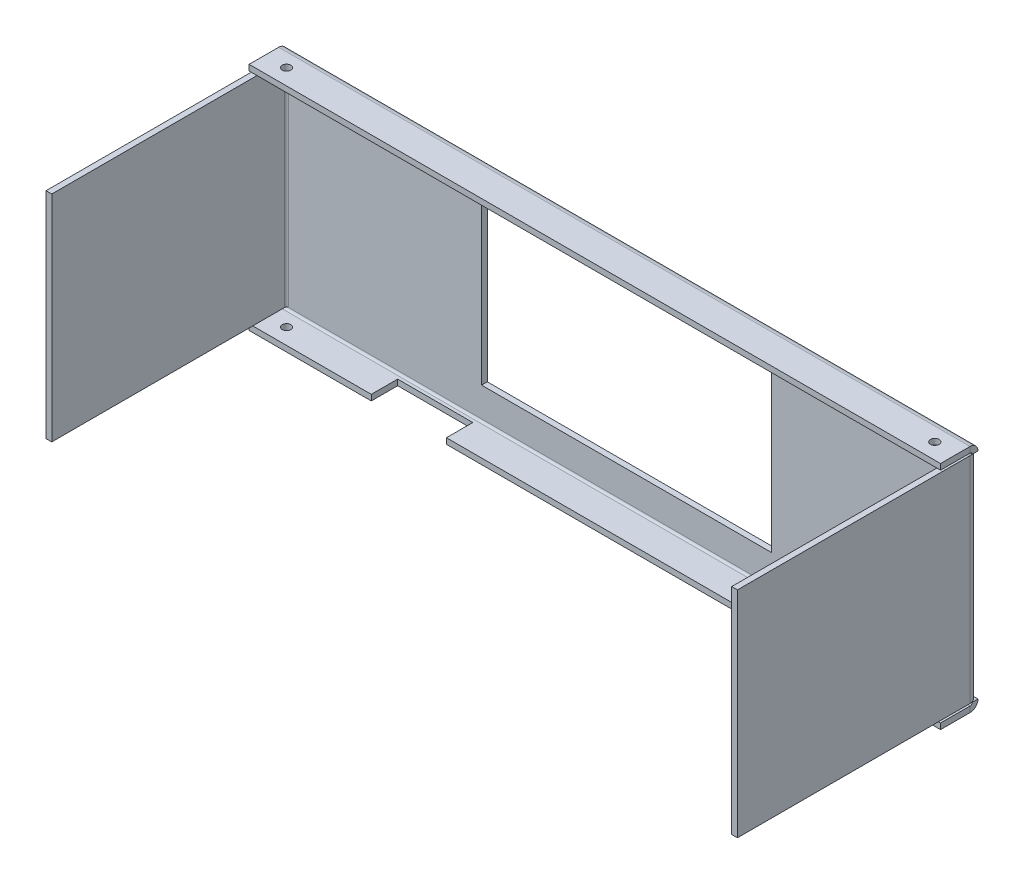
from build123d import *

# Parameters (mm, degrees)
SKETCH31_W                     = 240
SKETCH31_H                     = 80
BASE_FLANGE1_DEPTH             = 2
EDGE_FLANGE1_STRIP_W           = 9.4732
EDGE_FLANGE1_STRIP_H           = 2
EDGE_FLANGE1_STRIP_CUT_DEPTH   = 240
EDGE_FLANGE1_STRIP_2_W         = 9.4732
EDGE_FLANGE1_STRIP_2_H         = 2
EDGE_FLANGE1_STRIP_CUT_2_DEPTH = 240
EDGE_FLANGE1_DEPTH             = 240
EDGE_FLANGE1_BEND_DEPTH        = 240
EDGE_FLANGE2_STRIP_W           = 9.4732
EDGE_FLANGE2_STRIP_H           = 2
EDGE_FLANGE2_STRIP_CUT_DEPTH   = 74.5268
EDGE_FLANGE2_STRIP_2_W         = 9.4732
EDGE_FLANGE2_STRIP_2_H         = 2
EDGE_FLANGE2_STRIP_CUT_2_DEPTH = 74.5268
EDGE_FLANGE2_DEPTH             = 74.5268
EDGE_FLANGE2_BEND_DEPTH        = 74.5268
SKETCH52_W                     = 26.086706926
SKETCH52_H                     = 9.115658902
CUT_EXTRUDE2_DEPTH             = 10
SKETCH53_W                     = 26.086706926
SKETCH53_H                     = 0.049167759
CUT_EXTRUDE3_DEPTH             = 10
SKETCH61_R                     = 1.5
CUT_EXTRUDE8_DEPTH             = 167.29844137
SKETCH62_R                     = 1.5
CUT_EXTRUDE9_DEPTH             = 167.29844137
SKETCH65_W                     = 100.644593538
SKETCH65_H                     = 54.18299384
CUT_EXTRUDE11_DEPTH            = 153.543535722


# Sheet-metal steps are written as plain solids
with BuildPart() as part:
    # Base-Flange1: sheet metal written as solids
    # Sketch31 → Base-Flange1 (new body)
    with BuildSketch(Plane.XY):
        with Locations((-0.883917881, 4.881607463)):
            Rectangle(SKETCH31_W, SKETCH31_H)
    extrude(amount=-BASE_FLANGE1_DEPTH)

    # Edge-Flange1: sheet metal written as solids
    # Edge-Flange1 strip (on a plane across the edge) → Edge-Flange1 strip cut (cut)
    with BuildSketch(Plane(origin=(119.116082119, 44.881607463, 0), x_dir=(0, -1, 0), z_dir=(-1, 0, 0))):
        with Locations((-2, -1)):
            Rectangle(EDGE_FLANGE1_STRIP_W, EDGE_FLANGE1_STRIP_H)
    extrude(amount=EDGE_FLANGE1_STRIP_CUT_DEPTH, mode=Mode.SUBTRACT)

    # Edge-Flange1 strip 2 (on a plane across the edge) → Edge-Flange1 strip cut 2 (cut)
    with BuildSketch(Plane(origin=(-120.883917881, -35.118392537, 0), x_dir=(0, 1, 0), z_dir=(1, 0, 0))):
        with Locations((-2, -1)):
            Rectangle(EDGE_FLANGE1_STRIP_2_W, EDGE_FLANGE1_STRIP_2_H)
    extrude(amount=EDGE_FLANGE1_STRIP_CUT_2_DEPTH, mode=Mode.SUBTRACT)

    # Edge-Flange1 section (on a plane across the edge) → Edge-Flange1 (add)
    with BuildSketch(Plane(origin=(119.116082119, 44.881607463, 0), x_dir=(0, -1, 0), z_dir=(-1, 0, 0))):
        with BuildLine():
            Line((0, 0.7366), (0, 11))
            Line((0, 11), (2, 11))
            Line((2, 11), (2, 0.7366))
            ThreePointArc((2, 0.7366), (2.215745145, 0.215745145), (2.7366, 0))
            Line((2.7366, 0), (2.7366, -2))
            ThreePointArc((2.7366, -2), (0.801531583, -1.198468417), (0, 0.7366))
        make_face()
    extrude(amount=EDGE_FLANGE1_DEPTH)

    # Edge-Flange1 section 2 (on a plane across the edge) → Edge-Flange1 bend (add)
    with BuildSketch(Plane(origin=(-120.883917881, -35.118392537, 0), x_dir=(0, 1, 0), z_dir=(1, 0, 0))):
        with BuildLine():
            Line((0, 0.7366), (0, 11))
            Line((0, 11), (2, 11))
            Line((2, 11), (2, 0.7366))
            ThreePointArc((2, 0.7366), (2.215745145, 0.215745145), (2.7366, 0))
            Line((2.7366, 0), (2.7366, -2))
            ThreePointArc((2.7366, -2), (0.801531583, -1.198468417), (0, 0.7366))
        make_face()
    extrude(amount=EDGE_FLANGE1_BEND_DEPTH)

    # Edge-Flange2: sheet metal written as solids
    # Edge-Flange2 strip (on a plane across the edge) → Edge-Flange2 strip cut (cut)
    with BuildSketch(Plane(origin=(-120.883917881, 42.145007463, 0), x_dir=(1, 0, 0), z_dir=(0, -1, 0))):
        with Locations((-2, -1)):
            Rectangle(EDGE_FLANGE2_STRIP_W, EDGE_FLANGE2_STRIP_H)
    extrude(amount=EDGE_FLANGE2_STRIP_CUT_DEPTH, mode=Mode.SUBTRACT)

    # Edge-Flange2 strip 2 (on a plane across the edge) → Edge-Flange2 strip cut 2 (cut)
    with BuildSketch(Plane(origin=(119.116082119, -32.381792537, 0), x_dir=(-1, 0, 0), z_dir=(0, 1, 0))):
        with Locations((-2, -1)):
            Rectangle(EDGE_FLANGE2_STRIP_2_W, EDGE_FLANGE2_STRIP_2_H)
    extrude(amount=EDGE_FLANGE2_STRIP_CUT_2_DEPTH, mode=Mode.SUBTRACT)

    # Edge-Flange2 section (on a plane across the edge) → Edge-Flange2 (add)
    with BuildSketch(Plane(origin=(-120.883917881, 42.145007463, 0), x_dir=(1, 0, 0), z_dir=(0, -1, 0))):
        with BuildLine():
            Line((0, 0.7366), (0, 81.5))
            Line((0, 81.5), (2, 81.5))
            Line((2, 81.5), (2, 0.7366))
            ThreePointArc((2, 0.7366), (2.215745145, 0.215745145), (2.7366, 0))
            Line((2.7366, 0), (2.7366, -2))
            ThreePointArc((2.7366, -2), (0.801531583, -1.198468417), (0, 0.7366))
        make_face()
    extrude(amount=EDGE_FLANGE2_DEPTH)

    # Edge-Flange2 section 2 (on a plane across the edge) → Edge-Flange2 bend (add)
    with BuildSketch(Plane(origin=(119.116082119, -32.381792537, 0), x_dir=(-1, 0, 0), z_dir=(0, 1, 0))):
        with BuildLine():
            Line((0, 0.7366), (0, 81.5))
            Line((0, 81.5), (2, 81.5))
            Line((2, 81.5), (2, 0.7366))
            ThreePointArc((2, 0.7366), (2.215745145, 0.215745145), (2.7366, 0))
            Line((2.7366, 0), (2.7366, -2))
            ThreePointArc((2.7366, -2), (0.801531583, -1.198468417), (0, 0.7366))
        make_face()
    extrude(amount=EDGE_FLANGE2_BEND_DEPTH)

    # Sketch52 → Cut-Extrude2 (cut)
    with BuildSketch(Plane(origin=(0, -33.118392537, 0), x_dir=(1, 0, 0), z_dir=(0, 1, 0))):
        with Locations((-65.439575559, -6.39300279)):
            Rectangle(SKETCH52_W, SKETCH52_H)
    cut_extrude2 = extrude(amount=-CUT_EXTRUDE2_DEPTH, mode=Mode.SUBTRACT)

    # Sketch53 → Cut-Extrude3 (cut)
    with BuildSketch(Plane(origin=(0, -33.118392537, 0), x_dir=(1, 0, 0), z_dir=(0, 1, 0))):
        with Locations((-65.439575559, -10.975416121)):
            Rectangle(SKETCH53_W, SKETCH53_H)
    cut_extrude3 = extrude(amount=-CUT_EXTRUDE3_DEPTH, mode=Mode.SUBTRACT)

    # Mirror3: Cut-Extrude3 across plane
    add(cut_extrude3.mirror(Plane(origin=(0, 0, 0), x_dir=(0, 0, 1), z_dir=(1, 0, 0))), mode=Mode.SUBTRACT)

    # Mirror4: Cut-Extrude2, Cut-Extrude3 across plane
    add(cut_extrude2.mirror(Plane(origin=(0, 0, 0), x_dir=(0, 0, 1), z_dir=(1, 0, 0))), mode=Mode.SUBTRACT)
    add(cut_extrude3.mirror(Plane(origin=(0, 0, 0), x_dir=(0, 0, 1), z_dir=(1, 0, 0))), mode=Mode.SUBTRACT)

    # Sketch61 → Cut-Extrude8 (cut, through all)
    with BuildSketch(Plane(origin=(0, 44.881607463, 0), x_dir=(1, 0, 0), z_dir=(0, 1, 0))):
        with Locations(Location((111.616082119, -5.4966, 0), (0, 0, 270))):
            Circle(SKETCH61_R)
    extrude(amount=-CUT_EXTRUDE8_DEPTH, mode=Mode.SUBTRACT)

    # Sketch62 → Cut-Extrude9 (cut, through all)
    with BuildSketch(Plane(origin=(0, 44.881607463, 0), x_dir=(1, 0, 0), z_dir=(0, 1, 0))):
        with Locations(Location((-113.383917881, -5.4966, 0), (0, 0, 270))):
            Circle(SKETCH62_R)
    extrude(amount=-CUT_EXTRUDE9_DEPTH, mode=Mode.SUBTRACT)

    # Sketch65 → Cut-Extrude11 (cut, through all)
    with BuildSketch(Plane.XY):
        with Locations((-0.883917881, 4.881607463)):
            Rectangle(SKETCH65_W, SKETCH65_H)
    extrude(amount=-CUT_EXTRUDE11_DEPTH, mode=Mode.SUBTRACT)


solid = part.part
